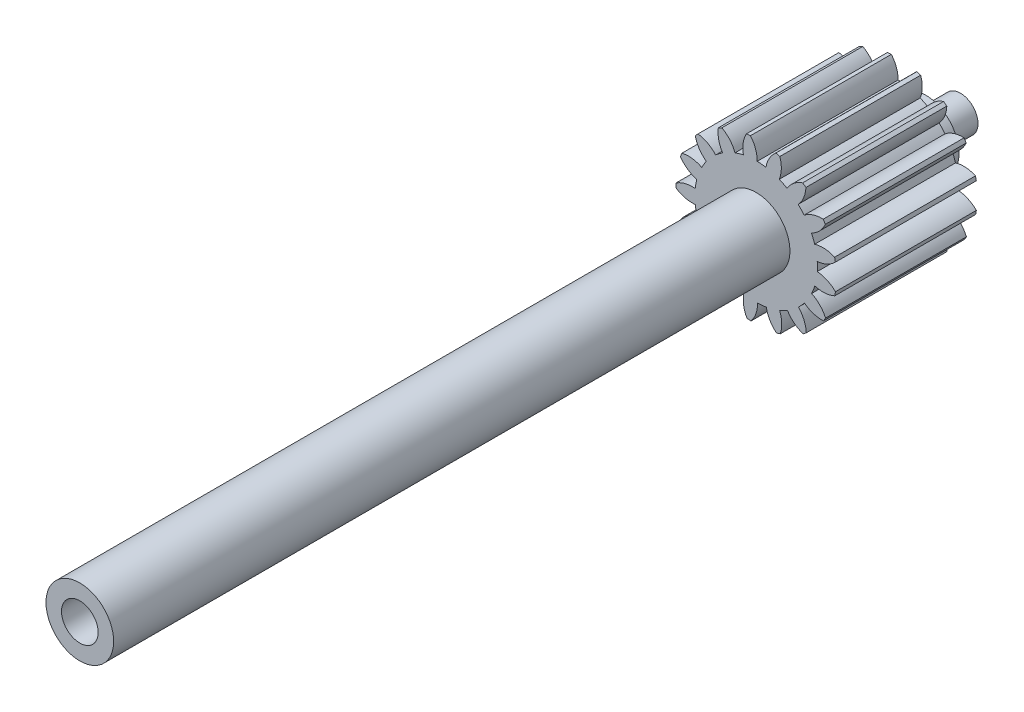
from build123d import *

# Parameters (mm, degrees)
SKETCH1_R           = 2.4
BOSS_EXTRUDE1_DEPTH = 60
SKETCH6_R           = 1.25
BOSS_EXTRUDE2_DEPTH = 2.5
SKETCH7_R           = 1.3
CUT_EXTRUDE1_DEPTH  = 2.5
JOIN2_START         = 2
JOIN2_OUTLINE_R     = 2.4
JOIN2_DEPTH         = 10


# Read off the part's stored shape, not the designer's step: Join2
with BuildPart() as part:
    # Sketch1 → Boss-Extrude1 (new body)
    with BuildSketch(Plane.XY):
        Circle(SKETCH1_R)
    extrude(amount=BOSS_EXTRUDE1_DEPTH)

    # Sketch6 → Boss-Extrude2 (add)
    with BuildSketch(Plane(origin=(0, 0, 0), x_dir=(-1, 0, 0), z_dir=(0, 0, -1))):
        Circle(SKETCH6_R)
    extrude(amount=BOSS_EXTRUDE2_DEPTH)

    # Sketch7 → Cut-Extrude1 (cut)
    with BuildSketch(Plane.XY.offset(60)):
        Circle(SKETCH7_R)
    extrude(amount=-CUT_EXTRUDE1_DEPTH, mode=Mode.SUBTRACT)

    # Join2 outline → Join2 (add)
    with BuildSketch(Plane.XY.offset(JOIN2_START)):
        with BuildLine():
            ThreePointArc((2.986969532, 3.160983077), (3.378378938, 3.767383023), (3.534131338, 4.472126528))
            ThreePointArc((3.534131338, 4.472126528), (3.42105158, 4.559211126), (3.305826871, 4.643437164))
            ThreePointArc((3.305826871, 4.643437164), (2.672723858, 4.296878666), (2.199922956, 3.751551677))
            ThreePointArc((2.199922956, 3.751551677), (1.926567958, 3.89899178), (1.643387346, 4.026546788))
            ThreePointArc((1.643387346, 4.026546788), (1.78930882, 4.733391284), (1.679960889, 5.446809287))
            ThreePointArc((1.679960889, 5.446809287), (1.54305857, 5.487164136), (1.405188775, 5.524078612))
            ThreePointArc((1.405188775, 5.524078612), (0.940029166, 4.972219249), (0.696150284, 4.29292159))
            ThreePointArc((0.696150284, 4.29292159), (0.387992831, 4.331658177), (0.077856591, 4.348303043))
            ThreePointArc((0.077856591, 4.348303043), (-0.04141737, 5.060128822), (-0.401097586, 5.68587027))
            ThreePointArc((-0.401097586, 5.68587027), (-0.54333305, 5.674045223), (-0.685227852, 5.658662633))
            ThreePointArc((-0.685227852, 5.658662633), (-0.919621674, 4.976034071), (-0.90164134, 4.254508655))
            ThreePointArc((-0.90164134, 4.254508655), (-1.202982876, 4.179310134), (-1.498189127, 4.082796877))
            ThreePointArc((-1.498189127, 4.082796877), (-1.866549914, 4.703467924), (-2.427985611, 5.157022966))
            ThreePointArc((-2.427985611, 5.157022966), (-2.556344531, 5.094615063), (-2.683100661, 5.02901291))
            ThreePointArc((-2.683100661, 5.02901291), (-2.655072511, 4.307807918), (-2.377661306, 3.64150075))
            ThreePointArc((-2.377661306, 3.64150075), (-2.631489081, 3.4625231), (-2.871896102, 3.26588637))
            ThreePointArc((-2.871896102, 3.26588637), (-3.439594549, 3.71157762), (-4.126960724, 3.931691135))
            ThreePointArc((-4.126960724, 3.931691135), (-4.224107518, 3.827128908), (-4.318605858, 3.720167126))
            ThreePointArc((-4.318605858, 3.720167126), (-4.031941094, 3.057788434), (-3.532564937, 2.536687991))
            ThreePointArc((-3.532564937, 2.536687991), (-3.704598104, 2.278103134), (-3.857737594, 2.007899811))
            ThreePointArc((-3.857737594, 2.007899811), (-4.548102881, 2.218418192), (-5.268566924, 2.17536263))
            ThreePointArc((-5.268566924, 2.17536263), (-5.321381378, 2.042767787), (-5.370859403, 1.908892158))
            ThreePointArc((-5.370859403, 1.908892158), (-4.864273689, 1.39479768), (-4.210376099, 1.089281462))
            ThreePointArc((-4.210376099, 1.089281462), (-4.277380625, 0.786012716), (-4.322570249, 0.478735257))
            ThreePointArc((-4.322570249, 0.478735257), (-5.042364718, 0.425649095), (-5.698623966, 0.125239347))
            ThreePointArc((-5.698623966, 0.125239347), (-5.699973196, -0.017480443), (-5.697748625, -0.160189273))
            ThreePointArc((-5.697748625, -0.160189273), (-5.039659169, -0.45656823), (-4.319552638, -0.505238564))
            ThreePointArc((-4.319552638, -0.505238564), (-4.272479191, -0.812233074), (-4.203615838, -1.115085146))
            ThreePointArc((-4.203615838, -1.115085146), (-4.855627257, -1.424606272), (-5.359050265, -1.941798203))
            ThreePointArc((-5.359050265, -1.941798203), (-5.308752049, -2.075367842), (-5.255125323, -2.207636255))
            ThreePointArc((-5.255125323, -2.207636255), (-4.534410753, -2.246272071), (-3.845349658, -2.031523322))
            ThreePointArc((-3.845349658, -2.031523322), (-3.690555767, -2.300782287), (-3.516939816, -2.558307122))
            ThreePointArc((-3.516939816, -2.558307122), (-4.013110431, -3.082460667), (-4.295707129, -3.746585146))
            ThreePointArc((-4.295707129, -3.746585146), (-4.200554521, -3.852965314), (-4.102768227, -3.956929729))
            ThreePointArc((-4.102768227, -3.956929729), (-3.416765039, -3.732604421), (-2.851810899, -3.283439599))
            ThreePointArc((-2.851810899, -3.283439599), (-2.610202337, -3.478598103), (-2.355281584, -3.656015544))
            ThreePointArc((-2.355281584, -3.656015544), (-2.628600803, -4.324011669), (-2.652204943, -5.045375005))
            ThreePointArc((-2.652204943, -5.045375005), (-2.52504883, -5.110198471), (-2.396309547, -5.171817916))
            ThreePointArc((-2.396309547, -5.171817916), (-1.837666272, -4.714827862), (-1.473119275, -4.091909163))
            ThreePointArc((-1.473119275, -4.091909163), (-1.177326617, -4.186609969), (-0.875529522, -4.259958809))
            ThreePointArc((-0.875529522, -4.259958809), (-0.889084071, -4.981580935), (-0.650507783, -5.662759012))
            ThreePointArc((-0.650507783, -5.662759012), (-0.508521301, -5.677271007), (-0.366215984, -5.688223436))
            ThreePointArc((-0.366215984, -5.688223436), (-0.010380493, -5.060287674), (0.104525269, -4.347743722))
            ThreePointArc((0.104525269, -4.347743722), (0.414553585, -4.329196961), (0.722467652, -4.288571031))
            ThreePointArc((0.722467652, -4.288571031), (0.970508391, -4.966360091), (1.439044058, -5.515356036))
            ThreePointArc((1.439044058, -5.515356036), (1.576684846, -5.477596635), (1.713337076, -5.436402861))
            ThreePointArc((1.713337076, -5.436402861), (1.818307229, -4.722327595), (1.668053097, -4.016391398))
            ThreePointArc((1.668053097, -4.016391398), (1.950446029, -3.887101914), (2.222891567, -3.737987972))
            ThreePointArc((2.222891567, -3.737987972), (2.699028318, -4.280404798), (3.334245025, -4.623073665))
            ThreePointArc((3.334245025, -4.623073665), (3.448950969, -4.538142485), (3.56149447, -4.450365955))
            ThreePointArc((3.56149447, -4.450365955), (3.401422484, -3.746591007), (3.006301111, -3.142603161))
            ThreePointArc((3.006301111, -3.142603161), (3.222919929, -2.920032214), (3.423101659, -2.682568924))
            ThreePointArc((3.423101659, -2.682568924), (4.063029514, -3.016357118), (4.779137726, -3.106419579))
            ThreePointArc((4.779137726, -3.106419579), (4.855417152, -2.985787046), (4.928652302, -2.863282467))
            ThreePointArc((4.928652302, -2.863282467), (4.525156785, -2.264856544), (3.938531501, -1.844388954))
            ThreePointArc((3.938531501, -1.844388954), (4.060120634, -1.558595984), (4.161002903, -1.264854079))
            ThreePointArc((4.161002903, -1.264854079), (4.87829606, -1.344933695), (5.578581394, -1.170226315))
            ThreePointArc((5.578581394, -1.170226315), (5.606132343, -1.030184521), (5.630168329, -0.889496816))
            ThreePointArc((5.630168329, -0.889496816), (5.037743587, -0.477240654), (4.338841388, -0.297079798))
            ThreePointArc((4.338841388, -0.297079798), (4.348979549, 0.013337271), (4.336937648, 0.323686319))
            ThreePointArc((4.336937648, 0.323686319), (5.034721691, 0.508130476), (5.624606733, 0.924012497))
            ThreePointArc((5.624606733, 0.924012497), (5.599708298, 1.064550132), (5.571298926, 1.204420309))
            ThreePointArc((5.571298926, 1.204420309), (4.869955203, 1.374829231), (4.153166704, 1.290351631))
            ThreePointArc((4.153166704, 1.290351631), (4.050484678, 1.583469253), (3.927144933, 1.868511086))
            ThreePointArc((3.927144933, 1.868511086), (4.511180261, 2.29256881), (4.910997766, 2.893458301))
            ThreePointArc((4.910997766, 2.893458301), (4.837012617, 3.01551139), (4.759994731, 3.135673797))
            ThreePointArc((4.759994731, 3.135673797), (4.044452383, 3.04122081), (3.406583842, 2.703513922))
            ThreePointArc((3.406583842, 2.703513922), (3.204949406, 2.939744939), (2.986969532, 3.160983077))
        make_face()
        Circle(JOIN2_OUTLINE_R, mode=Mode.SUBTRACT)
    extrude(amount=JOIN2_DEPTH)


solid = part.part
